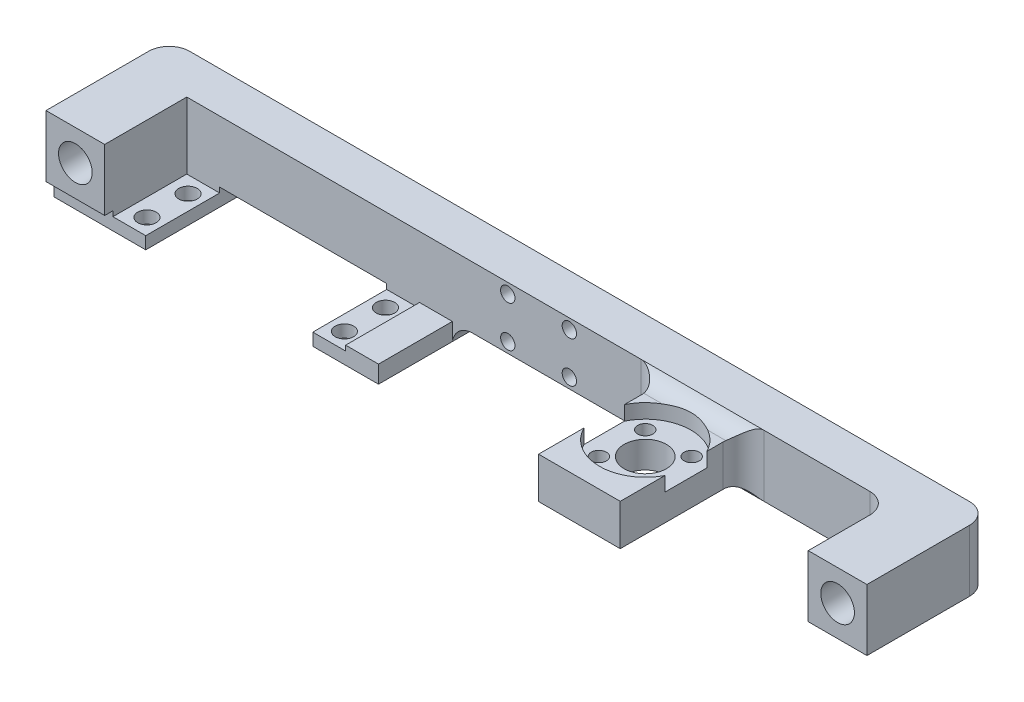
from build123d import *

# Parameters (mm, degrees)
ESQUISSE1_W             = 200
ESQUISSE1_H             = 15
ESQUISSE1_R             = 4.1
BOSS_EXTRU_1_DEPTH      = 10
BOSS_EXTRU_4_START      = -20
ESQUISSE11_W            = 14.3
ESQUISSE11_H            = 15
ESQUISSE11_R            = 4.1
BOSS_EXTRU_4_DEPTH      = 20
BOSS_EXTRU_5_DEPTH      = 18
BOSS_EXTRU_5_2_DEPTH    = 18
BOSS_EXTRU_9_DEPTH      = 10
ESQUISSE18_R            = 2.25
ENL_V_MAT_EXTRU_1_DEPTH = 104.266947762
ESQUISSE19_R            = 1.75
ENL_V_MAT_EXTRU_2_DEPTH = 103.655065632
ESQUISSE20_W            = 19.9
ESQUISSE20_H            = 30
BOSS_EXTRU_10_DEPTH     = 5
ESQUISSE21_R            = 11.15
ENL_V_MAT_EXTRU_3_DEPTH = 3.5
ESQUISSE22_R            = 5.15
ENL_V_MAT_EXTRU_4_DEPTH = 106.240498383
ESQUISSE23_R            = 1.85
ENL_V_MAT_EXTRU_5_DEPTH = 106.240498383
CONG_2_R                = 5


with BuildPart() as part:
    # Esquisse1 → Boss.-Extru.1 (new body)
    with BuildSketch(Plane.XY):
        Rectangle(ESQUISSE1_W, ESQUISSE1_H)
        with Locations((-92.85, 0)):
            Circle(ESQUISSE1_R, mode=Mode.SUBTRACT)
        with Locations((92.85, 0)):
            Circle(ESQUISSE1_R, mode=Mode.SUBTRACT)
    extrude(amount=-BOSS_EXTRU_1_DEPTH)

    # Esquisse11 → Boss.-Extru.4 (add)
    with BuildSketch(Plane(origin=(0, 0, 0), x_dir=(-1, 0, 0), z_dir=(0, 0, -1)).offset(BOSS_EXTRU_4_START)):
        with Locations((92.85, 0)):
            Rectangle(ESQUISSE11_W, ESQUISSE11_H)
        with Locations(Location((92.85, 0, 0), (0, 0, 180))):
            Circle(ESQUISSE11_R, mode=Mode.SUBTRACT)
    boss_extru_4 = extrude(amount=BOSS_EXTRU_4_DEPTH)

    # Symétrie1: Boss.-Extru.4 across plane
    add(boss_extru_4.mirror(Plane(origin=(0, 0, 0), x_dir=(0, 0, 1), z_dir=(1, 0, 0))))



with BuildPart() as body_2:
    # Esquisse12 → Boss.-Extru.5 (new body)
    with BuildSketch(Plane.XY):
        Polygon((-85.7, -8.75), (-77.7, -8.75), (-77.7, -11.75), (-100, -11.75), (-100, -7.5), (-85.7, -7.5), align=None)
    extrude(amount=BOSS_EXTRU_5_DEPTH)


with BuildPart() as body_3:
    # Esquisse12 → Boss.-Extru.5 2 (new body)
    with BuildSketch(Plane.XY):
        Polygon((-37, -8.75), (-29, -8.75), (-29, -7.5), (-21, -7.5), (-21, -11.75), (-37, -11.75), align=None)
    extrude(amount=BOSS_EXTRU_5_2_DEPTH)


with BuildPart() as part_1:
    add(part.part)

    add(body_2.part)  # Boss.-Extru.9 merges body 2

    add(body_3.part)  # Boss.-Extru.9 merges body 3
    # Esquisse17 → Boss.-Extru.9 (add)
    with BuildSketch(Plane(origin=(0, 0, 0), x_dir=(-1, 0, 0), z_dir=(0, 0, -1))):
        Polygon((85.7, -7.5), (77.7, -7.5), (77.7, -8.75), (77.7, -11.75), (100, -11.75), (100, -7.5), align=None)
        Polygon((37, -8.75), (37, -7.5), (29, -7.5), (21, -7.5), (21, -11.75), (37, -11.75), align=None)
    extrude(amount=BOSS_EXTRU_9_DEPTH)

    # Esquisse18 → Enlèv. mat.-Extru.1 (cut, through all)
    with BuildSketch(Plane(origin=(0, -8.75, 0), x_dir=(1, 0, 0), z_dir=(0, 1, 0))):
        with Locations(Location((-81.4, -4, 0), (0, 0, 270))):
            Circle(ESQUISSE18_R)
        with Locations(Location((-81.4, -14, 0), (0, 0, 270))):
            Circle(ESQUISSE18_R)
    enl_v_mat_extru_1 = extrude(amount=-ENL_V_MAT_EXTRU_1_DEPTH, mode=Mode.SUBTRACT)

    # Symétrie14: Enlèv. mat.-Extru.1 across plane
    add(enl_v_mat_extru_1.mirror(Plane.ZY.offset(57.35)), mode=Mode.SUBTRACT)

    # Esquisse19 → Enlèv. mat.-Extru.2 (cut, through all)
    with BuildSketch(Plane.XY):
        with Locations((-7.5, 5)):
            Circle(ESQUISSE19_R)
        with Locations((7.5, 5)):
            Circle(ESQUISSE19_R)
        with Locations((7.5, -5)):
            Circle(ESQUISSE19_R)
        with Locations((-7.5, -5)):
            Circle(ESQUISSE19_R)
    extrude(amount=-ENL_V_MAT_EXTRU_2_DEPTH, mode=Mode.SUBTRACT)

    # Esquisse20 → Boss.-Extru.10 (add, symmetric)
    with BuildSketch(Plane(origin=(0, 0, 0), x_dir=(1, 0, 0), z_dir=(0, 1, 0))):
        with Locations((39.95, -15)):
            Rectangle(ESQUISSE20_W, ESQUISSE20_H)
    extrude(amount=BOSS_EXTRU_10_DEPTH, both=True)

    # Esquisse21 → Enlèv. mat.-Extru.3 (cut)
    with BuildSketch(Plane(origin=(0, 5, 0), x_dir=(1, 0, 0), z_dir=(0, 1, 0))):
        with Locations((40, -14)):
            Circle(ESQUISSE21_R)
    extrude(amount=-ENL_V_MAT_EXTRU_3_DEPTH, mode=Mode.SUBTRACT)

    # Esquisse22 → Enlèv. mat.-Extru.4 (cut, through all)
    with BuildSketch(Plane(origin=(0, 1.5, 0), x_dir=(1, 0, 0), z_dir=(0, 1, 0))):
        with Locations(Location((40, -14, 0), (0, 0, 270))):
            Circle(ESQUISSE22_R)
    extrude(amount=-ENL_V_MAT_EXTRU_4_DEPTH, mode=Mode.SUBTRACT)

    # Esquisse23 → Enlèv. mat.-Extru.5 (cut, through all)
    with BuildSketch(Plane(origin=(0, 1.5, 0), x_dir=(1, 0, 0), z_dir=(0, 1, 0))):
        with Locations(Location((34.343145751, -8.343145751, 0), (0, 0, 270))):
            Circle(ESQUISSE23_R)
        with Locations(Location((45.656854249, -8.343145751, 0), (0, 0, 270))):
            Circle(ESQUISSE23_R)
        with Locations(Location((45.656854249, -19.656854249, 0), (0, 0, 270))):
            Circle(ESQUISSE23_R)
        with Locations(Location((34.343145751, -19.656854249, 0), (0, 0, 270))):
            Circle(ESQUISSE23_R)
    extrude(amount=-ENL_V_MAT_EXTRU_5_DEPTH, mode=Mode.SUBTRACT)

    # Congé2
    # the kernel refuses this fillet: 5 mm, written as the material it adds along each edge
    with BuildSketch(Plane(origin=(30, -5, 0), x_dir=(-1, 0, 0), z_dir=(0, 1, 0)), Plane(origin=(49.9, 5, 0), x_dir=(1, 0, 0), z_dir=(0, -1, 0))) as cong_2_piece_1:
        with BuildLine():
            CenterArc((CONG_2_R, CONG_2_R), CONG_2_R, 180, 90)
            Line((0, CONG_2_R), (0, 0))
            Line((0, 0), (CONG_2_R, 0))
        make_face()
    extrude(amount=10)
    with BuildSketch(Plane(origin=(30, -5, 0), x_dir=(0, -1, 0), z_dir=(1, 0, 0))) as cong_2_piece_2:
        with BuildLine():
            CenterArc((5, -4.330127019), CONG_2_R, 120, 60)
            Line((0, -4.330127019), (0, 0))
            Line((0, 0), (2.5, 0))
        make_face()
    extrude(amount=19.9)
    with BuildSketch(Plane(origin=(30, 5, 0), x_dir=(0, 1, 0), z_dir=(1, 0, 0))) as cong_2_piece_3_section:
        with BuildLine():
            CenterArc((5, 4.330127019), CONG_2_R, 180, 60)
            Line((0, 4.330127019), (0, 0))
            Line((0, 0), (2.5, 0))
        make_face()
    cong_2_piece_3 = extrude(amount=19.9, mode=Mode.PRIVATE)
    cong_2_piece_3 = cong_2_piece_3 - Plane(origin=(40, 5, 14), x_dir=(1, 0, 0), z_dir=(0, 1, 0)) * Cylinder(11.15, 58, mode=Mode.PRIVATE)
    add(cong_2_piece_3)
    with BuildSketch(Plane(origin=(85.7, 7.5, 0), x_dir=(0, 0, 1), z_dir=(0, -1, 0))) as cong_2_piece_4:
        with BuildLine():
            CenterArc((CONG_2_R, CONG_2_R), CONG_2_R, 180, 90)
            Line((0, CONG_2_R), (0, 0))
            Line((0, 0), (CONG_2_R, 0))
        make_face()
    extrude(amount=15)
    with BuildSketch(Plane(origin=(-21, -7.5, 0), x_dir=(1, 0, 0), z_dir=(0, 0, -1))) as cong_2_piece_5:
        with BuildLine():
            CenterArc((4.943429983, 5), CONG_2_R, 188.626926559, 81.373073441)
            Line((0, 4.25), (0, 0))
            Line((0, 0), (4.943429983, 0))
        make_face()
    extrude(amount=10)
    with BuildSketch(Plane(origin=(30, -17.5, 0), x_dir=(-1, 0, 0), z_dir=(0, 1, 0))) as cong_2_piece_6a_section:
        with BuildLine():
            CenterArc((CONG_2_R, CONG_2_R), CONG_2_R, 180, 90)
            Line((0, CONG_2_R), (0, 0))
            Line((0, 0), (CONG_2_R, 0))
        make_face()
    cong_2_piece_6a = extrude(amount=22.5, mode=Mode.PRIVATE)
    cong_2_piece_6a = split(cong_2_piece_6a, bisect_by=Plane(origin=(30, -7.5, 0), z_dir=(0, 1, 0)), keep=Keep.TOP, mode=Mode.PRIVATE)
    cong_2_piece_6a = split(cong_2_piece_6a, bisect_by=Plane(origin=(30, -5, 0), z_dir=(0, -1, 0)), keep=Keep.TOP, mode=Mode.PRIVATE)
    with BuildSketch(Plane(origin=(19.174682453, -5, 0), x_dir=(0, -1, 0), z_dir=(1, 0, 0))) as cong_2_piece_6b_section:
        with BuildLine():
            CenterArc((5, -4.330127019), CONG_2_R, 120, 60)
            Line((0, -4.330127019), (0, 0))
            Line((0, 0), (2.5, 0))
        make_face()
    cong_2_piece_6b = extrude(amount=30.725317547, mode=Mode.PRIVATE)
    cong_2_piece_6b = split(cong_2_piece_6b, bisect_by=Plane(origin=(30, -5, 0), z_dir=(-1, 0, 0)), keep=Keep.TOP, mode=Mode.PRIVATE)
    cong_2_piece_6 = cong_2_piece_6a & cong_2_piece_6b
    add(cong_2_piece_6)
    with BuildSketch(Plane(origin=(30, -5, 0), x_dir=(-1, 0, 0), z_dir=(0, 1, 0))) as cong_2_piece_7a_section:
        with BuildLine():
            CenterArc((CONG_2_R, CONG_2_R), CONG_2_R, 180, 90)
            Line((0, CONG_2_R), (0, 0))
            Line((0, 0), (CONG_2_R, 0))
        make_face()
    cong_2_piece_7a = extrude(amount=22.5, mode=Mode.PRIVATE)
    cong_2_piece_7a = split(cong_2_piece_7a, bisect_by=Plane(origin=(30, 7.5, 0), z_dir=(0, -1, 0)), keep=Keep.TOP, mode=Mode.PRIVATE)
    cong_2_piece_7a = split(cong_2_piece_7a, bisect_by=Plane(origin=(30, 5, 0), z_dir=(0, 1, 0)), keep=Keep.TOP, mode=Mode.PRIVATE)
    with BuildSketch(Plane(origin=(19.174682453, 5, 0), x_dir=(0, 1, 0), z_dir=(1, 0, 0))) as cong_2_piece_7b_section:
        with BuildLine():
            CenterArc((5, 4.330127019), CONG_2_R, 180, 60)
            Line((0, 4.330127019), (0, 0))
            Line((0, 0), (2.5, 0))
        make_face()
    cong_2_piece_7b = extrude(amount=30.725317547, mode=Mode.PRIVATE)
    cong_2_piece_7b = split(cong_2_piece_7b, bisect_by=Plane(origin=(30, 5, 0), z_dir=(-1, 0, 0)), keep=Keep.TOP, mode=Mode.PRIVATE)
    cong_2_piece_7 = cong_2_piece_7a & cong_2_piece_7b
    add(cong_2_piece_7)
    with BuildSketch(Plane(origin=(49.9, 5, 0), x_dir=(1, 0, 0), z_dir=(0, -1, 0))) as cong_2_piece_8a_section:
        with BuildLine():
            CenterArc((CONG_2_R, CONG_2_R), CONG_2_R, 180, 90)
            Line((0, CONG_2_R), (0, 0))
            Line((0, 0), (CONG_2_R, 0))
        make_face()
    cong_2_piece_8a = extrude(amount=22.5, mode=Mode.PRIVATE)
    cong_2_piece_8a = split(cong_2_piece_8a, bisect_by=Plane(origin=(49.9, -7.5, 0), z_dir=(0, 1, 0)), keep=Keep.TOP, mode=Mode.PRIVATE)
    cong_2_piece_8a = split(cong_2_piece_8a, bisect_by=Plane(origin=(49.9, -5, 0), z_dir=(0, -1, 0)), keep=Keep.TOP, mode=Mode.PRIVATE)
    with BuildSketch(Plane(origin=(30, -5, 0), x_dir=(0, -1, 0), z_dir=(1, 0, 0))) as cong_2_piece_8b_section:
        with BuildLine():
            CenterArc((5, -4.330127019), CONG_2_R, 120, 60)
            Line((0, -4.330127019), (0, 0))
            Line((0, 0), (2.5, 0))
        make_face()
    cong_2_piece_8b = extrude(amount=30.725317547, mode=Mode.PRIVATE)
    cong_2_piece_8b = split(cong_2_piece_8b, bisect_by=Plane(origin=(49.9, -5, 0), z_dir=(1, 0, 0)), keep=Keep.TOP, mode=Mode.PRIVATE)
    cong_2_piece_8 = cong_2_piece_8a & cong_2_piece_8b
    add(cong_2_piece_8)
    with BuildSketch(Plane(origin=(30, 5, 0), x_dir=(0, 1, 0), z_dir=(1, 0, 0))) as cong_2_piece_9a_section:
        with BuildLine():
            CenterArc((5, 4.330127019), CONG_2_R, 180, 60)
            Line((0, 4.330127019), (0, 0))
            Line((0, 0), (2.5, 0))
        make_face()
    cong_2_piece_9a = extrude(amount=30.725317547, mode=Mode.PRIVATE)
    cong_2_piece_9a = split(cong_2_piece_9a, bisect_by=Plane(origin=(49.9, 5, 0), z_dir=(1, 0, 0)), keep=Keep.TOP, mode=Mode.PRIVATE)
    with BuildSketch(Plane(origin=(49.9, 17.5, 0), x_dir=(1, 0, 0), z_dir=(0, -1, 0))) as cong_2_piece_9b_section:
        with BuildLine():
            CenterArc((CONG_2_R, CONG_2_R), CONG_2_R, 180, 90)
            Line((0, CONG_2_R), (0, 0))
            Line((0, 0), (CONG_2_R, 0))
        make_face()
    cong_2_piece_9b = extrude(amount=22.5, mode=Mode.PRIVATE)
    cong_2_piece_9b = split(cong_2_piece_9b, bisect_by=Plane(origin=(49.9, 7.5, 0), z_dir=(0, -1, 0)), keep=Keep.TOP, mode=Mode.PRIVATE)
    cong_2_piece_9b = split(cong_2_piece_9b, bisect_by=Plane(origin=(49.9, 5, 0), z_dir=(0, 1, 0)), keep=Keep.TOP, mode=Mode.PRIVATE)
    cong_2_piece_9 = cong_2_piece_9a & cong_2_piece_9b
    add(cong_2_piece_9)
    # the kernel refuses this fillet: 5 mm, written as the material it takes off along each edge
    with BuildSketch(Plane(origin=(100, 20, -10), x_dir=(-1, 0, 0), z_dir=(0, -1, 0))) as cong_2_2_piece_1:
        with BuildLine():
            CenterArc((CONG_2_R, -CONG_2_R), CONG_2_R, 90, 90)
            Line((0, -CONG_2_R), (0, 0))
            Line((0, 0), (CONG_2_R, 0))
        make_face()
    extrude(amount=40, mode=Mode.SUBTRACT)
    with BuildSketch(Plane(origin=(-100, -7.5, -10), x_dir=(0, 0, 1), z_dir=(0, 1, 0))) as cong_2_2_piece_2:
        with BuildLine():
            CenterArc((CONG_2_R, CONG_2_R), CONG_2_R, 180, 90)
            Line((0, CONG_2_R), (0, 0))
            Line((0, 0), (CONG_2_R, 0))
        make_face()
    extrude(amount=27.5, mode=Mode.SUBTRACT)
    with BuildSketch(Plane(origin=(-100, -24.25, -10), x_dir=(0, 0, 1), z_dir=(0, 1, 0))) as cong_2_2_piece_3:
        with BuildLine():
            CenterArc((CONG_2_R, CONG_2_R), CONG_2_R, 180, 90)
            Line((0, CONG_2_R), (0, 0))
            Line((0, 0), (CONG_2_R, 0))
        make_face()
    extrude(amount=16.75, mode=Mode.SUBTRACT)


solid = part_1.part
